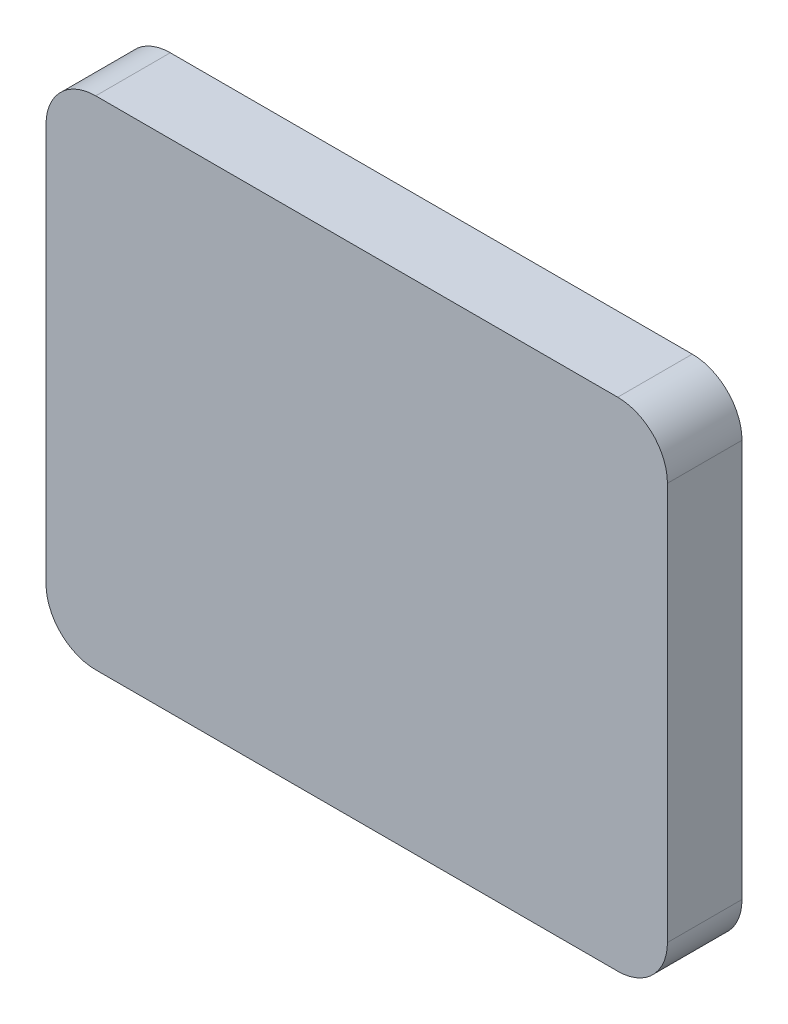
from build123d import *

# Parameters (mm, degrees)
ESBO_O1_W                = 25
ESBO_O1_H                = 20
RESSALTO_EXTRUS_O1_DEPTH = 3
FILETE1_R                = 2


with BuildPart() as part:
    # Esboço1 → Ressalto-extrusão1 (new body)
    with BuildSketch(Plane.XY):
        Rectangle(ESBO_O1_W, ESBO_O1_H)
    extrude(amount=RESSALTO_EXTRUS_O1_DEPTH)

    # Filete1
    filete1_edges = [part.edges().sort_by_distance(p)[0] for p in [
        (-12.5, 10, 1.5),
        (-12.5, -10, 1.5),
        (12.5, -10, 1.5),
        (12.5, 10, 1.5),
    ]]
    fillet(filete1_edges, radius=FILETE1_R)


solid = part.part
